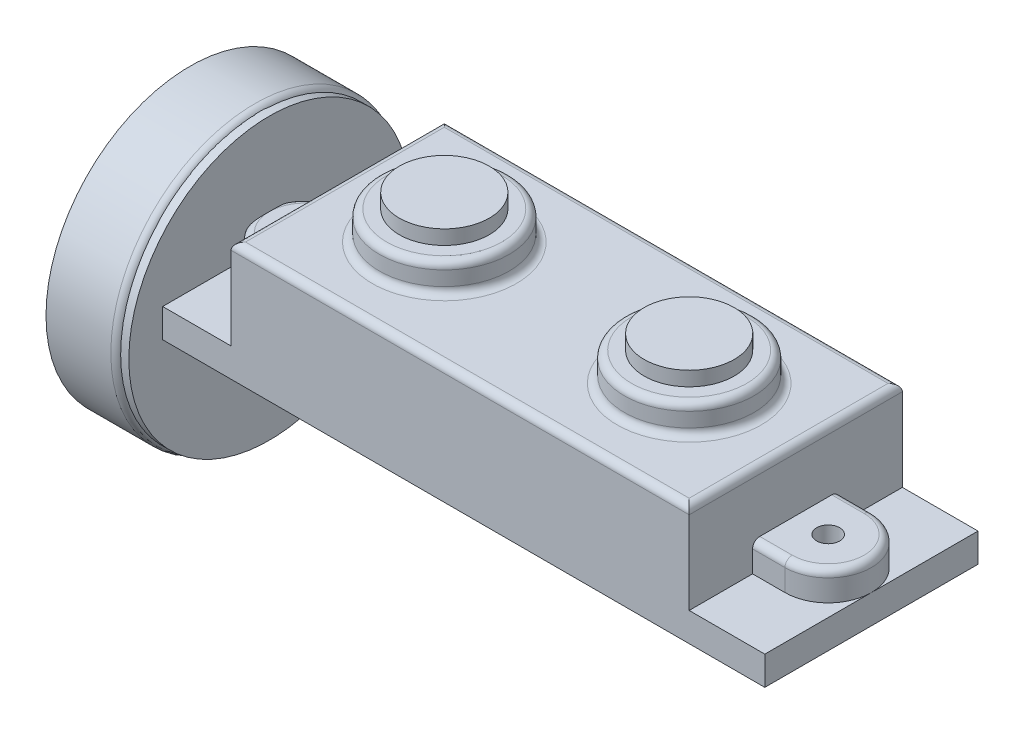
from build123d import *

# Parameters (mm, degrees)
SKETCH1_W                = 63.6
SKETCH1_H                = 29.6
BOSS_EXTRUDE1_DEPTH      = 12.5
SKETCH2_R                = 9
BOSS_EXTRUDE2_DEPTH      = 4
SKETCH3_R                = 6.25
BOSS_EXTRUDE3_DEPTH      = 2
SKETCH5_R                = 1.6
BOSS_EXTRUDE4_DEPTH      = 4
FILLET1_R                = 1
FILLET2_R                = 1
FILLET3_R                = 1
SKETCH6_W                = 84.6
SKETCH6_H                = 29.6
SKETCH6_R                = 1.6
BOSS_EXTRUDE5_DEPTH      = 4
SKETCH7_R                = 20
SKETCH7_R_2              = 18
BOSS_EXTRUDE6_DEPTH      = 10
BOSS_EXTRUDE9_DEPTH      = 5
BOSS_EXTRUDE9_DEPTH_BACK = 1
SKETCH8_R                = 19.5
FILLET5_R                = 1


with BuildPart() as part:
    # Sketch1 → Boss-Extrude1 (new body)
    with BuildSketch(Plane(origin=(0, 0, 0), x_dir=(1, 0, 0), z_dir=(0, 1, 0))):
        Rectangle(SKETCH1_W, SKETCH1_H)
    extrude(amount=BOSS_EXTRUDE1_DEPTH)

    # Sketch2 → Boss-Extrude2 (add)
    with BuildSketch(Plane(origin=(0, 12.5, 0), x_dir=(1, 0, 0), z_dir=(0, 1, 0))):
        with Locations((-17, 0)):
            Circle(SKETCH2_R)
        with Locations((17, 0)):
            Circle(SKETCH2_R)
    extrude(amount=BOSS_EXTRUDE2_DEPTH)

    # Sketch3 → Boss-Extrude3 (add)
    with BuildSketch(Plane(origin=(0, 16.5, 0), x_dir=(1, 0, 0), z_dir=(0, 1, 0))):
        with Locations((-17, 0)):
            Circle(SKETCH3_R)
        with Locations((17, 0)):
            Circle(SKETCH3_R)
    extrude(amount=BOSS_EXTRUDE3_DEPTH)

    # Sketch5 → Boss-Extrude4 (add)
    # profile 1 of 2: a face of its own
    with BuildSketch(Plane(origin=(0, 0, 0), x_dir=(1, 0, 0), z_dir=(0, 1, 0))):
        with BuildLine():
            Line((-36.3, 6), (-31.8, 6))
            Line((-31.8, 6), (-31.8, -6))
            Line((-31.8, -6), (-36.3, -6))
            ThreePointArc((-36.3, -6), (-42.3, 0), (-36.3, 6))
        make_face()
        with Locations((-36.3, 0)):
            Circle(SKETCH5_R, mode=Mode.SUBTRACT)
    # profile 2 of 2: a face of its own
    with BuildSketch(Plane(origin=(0, 0, 0), x_dir=(1, 0, 0), z_dir=(0, 1, 0))):
        with BuildLine():
            Line((31.8, -6), (36.3, -6))
            ThreePointArc((36.3, -6), (42.3, 0), (36.3, 6))
            Line((36.3, 6), (31.8, 6))
            Line((31.8, 6), (31.8, -6))
        make_face()
        with Locations((36.3, 0)):
            Circle(SKETCH5_R, mode=Mode.SUBTRACT)
    extrude(amount=BOSS_EXTRUDE4_DEPTH)

    # Fillet1
    fillet1_edges = [part.edges().sort_by_distance(p)[0] for p in [
        (0, 12.5, 14.8),
        (-31.8, 12.5, 0),
        (0, 12.5, -14.8),
        (31.8, 12.5, 0),
        (8, 12.5, 0),
        (-26, 12.5, 0),
    ]]
    fillet(fillet1_edges, radius=FILLET1_R)

    # Fillet2
    fillet2_edges = [part.edges().sort_by_distance(p)[0] for p in [
        (8, 16.5, 0),
        (-26, 16.5, 0),
    ]]
    fillet(fillet2_edges, radius=FILLET2_R)

    # Fillet3
    fillet3_edges = [part.edges().sort_by_distance(p)[0] for p in [
        (34.05, 4, 6),
        (34.05, 4, -6),
        (-34.05, 4, -6),
        (-34.05, 4, 6),
        (42.3, 4, 0),
        (-42.3, 4, 0),
    ]]
    fillet(fillet3_edges, radius=FILLET3_R)



with BuildPart() as body_2:
    # Sketch6 → Boss-Extrude5 (new body)
    with BuildSketch(Plane.XZ):
        Rectangle(SKETCH6_W, SKETCH6_H)
        with Locations((36.3, 0)):
            Circle(SKETCH6_R, mode=Mode.SUBTRACT)
        with Locations((-36.3, 0)):
            Circle(SKETCH6_R, mode=Mode.SUBTRACT)
    extrude(amount=BOSS_EXTRUDE5_DEPTH)


with BuildPart() as part_1:
    add(part.part)

    add(body_2.part)  # Boss-Extrude6 merges body 2
    # Sketch7 → Boss-Extrude6 (add)
    with BuildSketch(Plane.ZY.offset(42.3)):
        with Locations((0, -4)):
            Circle(SKETCH7_R)
        with Locations((0, -4)):
            Circle(SKETCH7_R_2, mode=Mode.SUBTRACT)
    extrude(amount=BOSS_EXTRUDE6_DEPTH)

    # Fillet5
    fillet5_edges = [part_1.edges().sort_by_distance(p)[0] for p in [
        (-42.3, -4, -20),
    ]]
    fillet(fillet5_edges, radius=FILLET5_R)


with BuildPart() as body_2_2:
    # Sketch8 → Boss-Extrude9 (new, two sides: drawn at the far end of the back side and taken through both)
    with BuildSketch(Plane.ZY.offset(42.3).offset(-BOSS_EXTRUDE9_DEPTH_BACK)):
        with Locations((0, -4)):
            Circle(SKETCH8_R)
    extrude(amount=BOSS_EXTRUDE9_DEPTH + BOSS_EXTRUDE9_DEPTH_BACK)


solid = Compound([part_1.part, body_2_2.part])
